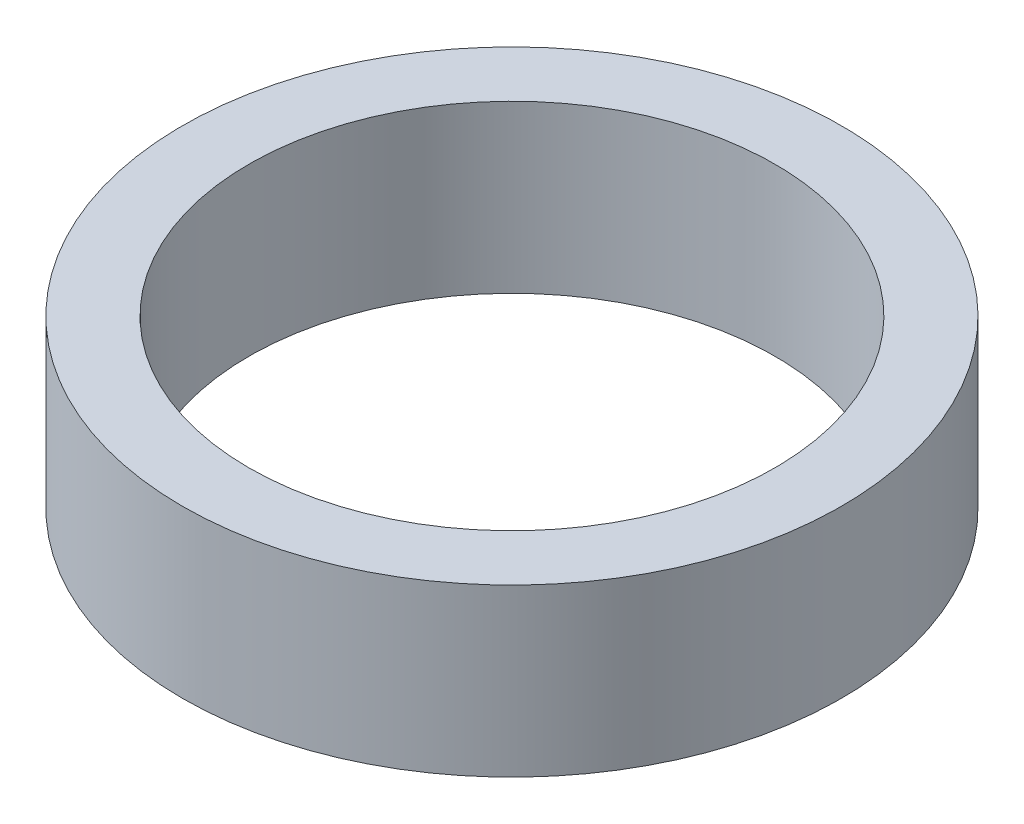
from build123d import *

# Parameters (mm, degrees)
SKETCH1_R           = 15.725
SKETCH1_R_2         = 12.55
BOSS_EXTRUDE1_DEPTH = 3.96875


with BuildPart() as part:
    # Sketch1 → Boss-Extrude1 (new, symmetric)
    with BuildSketch(Plane(origin=(0, 0, 0), x_dir=(1, 0, 0), z_dir=(0, 1, 0))):
        Circle(SKETCH1_R)
        Circle(SKETCH1_R_2, mode=Mode.SUBTRACT)
    extrude(amount=BOSS_EXTRUDE1_DEPTH, both=True)


solid = part.part
